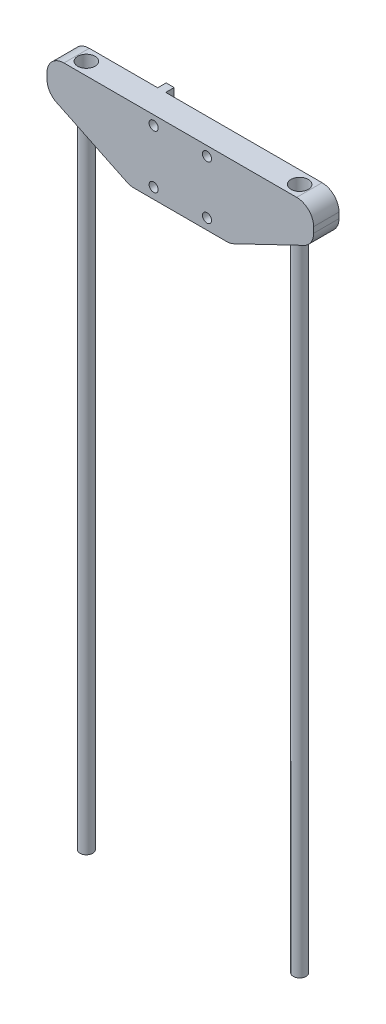
from build123d import *

# Parameters (mm, degrees)
BOSS_EXTRUDE1_DEPTH            = 4.7625
CUT_EXTRUDE1_DEPTH             = 10
SKETCH4_W                      = 2.38125
SKETCH4_H                      = 243.6
SKETCH4_3_W                    = 2.38125
SKETCH4_3_H                    = 243.6
SKETCH6_W                      = 1.7
SKETCH6_H                      = 9.525
M3_CLEARANCE_HOLE1_AT_2_COUNT  = 2
M3_CLEARANCE_HOLE1_AT_2_PITCH  = 20
M3_CLEARANCE_HOLE1_AT_3_COUNT  = 2
M3_CLEARANCE_HOLE1_AT_3_PITCH  = 28.284271247
M3_CLEARANCE_HOLE1_AT_4_COUNT  = 2
M3_CLEARANCE_HOLE1_AT_4_PITCH  = 20
CBORE_FOR_M3_SHCS2_AT_2_COUNT  = 2
CBORE_FOR_M3_SHCS2_AT_2_PITCH  = 80
M3X0_5_TAPPED_HOLE1_AT_2_COUNT = 2
M3X0_5_TAPPED_HOLE1_AT_2_PITCH = 80
FILLET1_R                      = 6.35
SKETCH16_W                     = 3
SKETCH16_H                     = 24.5
BOSS_EXTRUDE2_DEPTH            = 3.175


with BuildPart() as part:
    # Sketch3 → Boss-Extrude1 (new, symmetric)
    with BuildSketch(Plane.XY):
        Polygon((-50, 12.5), (-50, 0), (-18.75, -15), (18.75, -15), (50, 0), (50, 12.5), align=None)
    extrude(amount=BOSS_EXTRUDE1_DEPTH, both=True)

    # Sketch10 → Cut-Extrude1 (cut)
    with BuildSketch(Plane(origin=(0, 0, 0), x_dir=(1, 0, 0), z_dir=(0, 1, 0))):
        with BuildLine():
            Line((40, 2.38125), (35, 2.38125))
            ThreePointArc((35, 2.38125), (32.61875, 0), (35, -2.38125))
            Line((35, -2.38125), (40, -2.38125))
            ThreePointArc((40, -2.38125), (42.38125, 0), (40, 2.38125))
        make_face()
        with BuildLine():
            Line((-40, 2.38125), (-35, 2.38125))
            ThreePointArc((-35, 2.38125), (-32.61875, 0), (-35, -2.38125))
            Line((-35, -2.38125), (-40, -2.38125))
            ThreePointArc((-40, -2.38125), (-42.38125, 0), (-40, 2.38125))
        make_face()
    extrude(amount=-CUT_EXTRUDE1_DEPTH, mode=Mode.SUBTRACT)

    # Sketch6 → M3 Clearance Hole1 (revolve, cut)
    with BuildSketch(Plane(origin=(-10, 9, 4.7625), x_dir=(0, -1, 0), z_dir=(1, 0, 0))):
        with Locations((0.85, 4.7625)):
            Rectangle(SKETCH6_W, SKETCH6_H)
    m3_clearance_hole1 = revolve(axis=Axis((-10, 9, 11.1125), (0, 0, -1)), mode=Mode.SUBTRACT)

    # M3 Clearance Hole1 at 2: M3 Clearance Hole1 ×2
    with Locations(*[(0, -i * M3_CLEARANCE_HOLE1_AT_2_PITCH, 0) for i in range(1, M3_CLEARANCE_HOLE1_AT_2_COUNT)]):
        add(m3_clearance_hole1, mode=Mode.SUBTRACT)

    # M3 Clearance Hole1 at 3: M3 Clearance Hole1 ×2
    with Locations(*[Vector(0.707106781186549, -0.707106781186546, 0) * (i * M3_CLEARANCE_HOLE1_AT_3_PITCH) for i in range(1, M3_CLEARANCE_HOLE1_AT_3_COUNT)]):
        add(m3_clearance_hole1, mode=Mode.SUBTRACT)

    # M3 Clearance Hole1 at 4: M3 Clearance Hole1 ×2
    with Locations(*[(i * M3_CLEARANCE_HOLE1_AT_4_PITCH, 0, 0) for i in range(1, M3_CLEARANCE_HOLE1_AT_4_COUNT)]):
        add(m3_clearance_hole1, mode=Mode.SUBTRACT)

    # Sketch12 → CBORE for M3 SHCS2 (revolve, cut)
    with BuildSketch(Plane(origin=(-40, 12.5, 0), x_dir=(0, 0, 1), z_dir=(1, 0, 0))):
        Polygon((0, 0), (0, 256.1), (1.8, 256.1), (1.8, 11), (3.25, 11), (3.25, 0), align=None)
    cbore_for_m3_shcs2 = revolve(axis=Axis((-40, 18.85, 0), (0, -1, 0)), mode=Mode.SUBTRACT)

    # CBORE for M3 SHCS2 at 2: CBORE for M3 SHCS2 ×2
    with Locations(*[(i * CBORE_FOR_M3_SHCS2_AT_2_PITCH, 0, 0) for i in range(1, CBORE_FOR_M3_SHCS2_AT_2_COUNT)]):
        add(cbore_for_m3_shcs2, mode=Mode.SUBTRACT)

    # Fillet1
    fillet1_edges = [part.edges().sort_by_distance(p)[0] for p in [
        (-18.75, -15, 0),
        (18.75, -15, 0),
        (50, 0, 0),
        (50, 12.5, 0),
        (-50, 12.5, 0),
        (-50, 0, 0),
    ]]
    fillet(fillet1_edges, radius=FILLET1_R)

    # Sketch16 → Boss-Extrude2 (add)
    with BuildSketch(Plane(origin=(0, 0, -4.7625), x_dir=(-1, 0, 0), z_dir=(0, 0, -1))):
        with Locations((16.5, 0.25)):
            Rectangle(SKETCH16_W, SKETCH16_H)
    extrude(amount=BOSS_EXTRUDE2_DEPTH)


with BuildPart() as body_2:
    # Sketch4 → Revolve1 (revolve)
    with BuildSketch(Plane.XY):
        with Locations((-41.190625, -121.8)):
            Rectangle(SKETCH4_W, SKETCH4_H)
    revolve(axis=Axis((-40, -243.6, 0), (0, -1, 0)))

    # Sketch14 → M3x0.5 Tapped Hole1 (revolve, cut)
    with BuildSketch(Plane(origin=(-40, 0, 0), x_dir=(0, 0, 1), z_dir=(1, 0, 0))):
        Polygon((0, 0), (0, 8.251075774), (1.25, 7.5), (1.25, 0), align=None)
    m3x0_5_tapped_hole1 = revolve(axis=Axis((-40, 6.35, 0), (0, -1, 0)), mode=Mode.SUBTRACT)


with BuildPart() as body_3:
    # Sketch4<3> → Revolve2 (revolve)
    with BuildSketch(Plane.XY):
        with Locations((38.809375, -121.8)):
            Rectangle(SKETCH4_3_W, SKETCH4_3_H)
    revolve(axis=Axis((40, -243.6, 0), (0, -1, 0)))

    # M3x0.5 Tapped Hole1 at 2: M3x0.5 Tapped Hole1 ×2
    with Locations(*[(i * M3X0_5_TAPPED_HOLE1_AT_2_PITCH, 0, 0) for i in range(1, M3X0_5_TAPPED_HOLE1_AT_2_COUNT)]):
        add(m3x0_5_tapped_hole1, mode=Mode.SUBTRACT)


solid = Compound([part.part, body_2.part, body_3.part])
